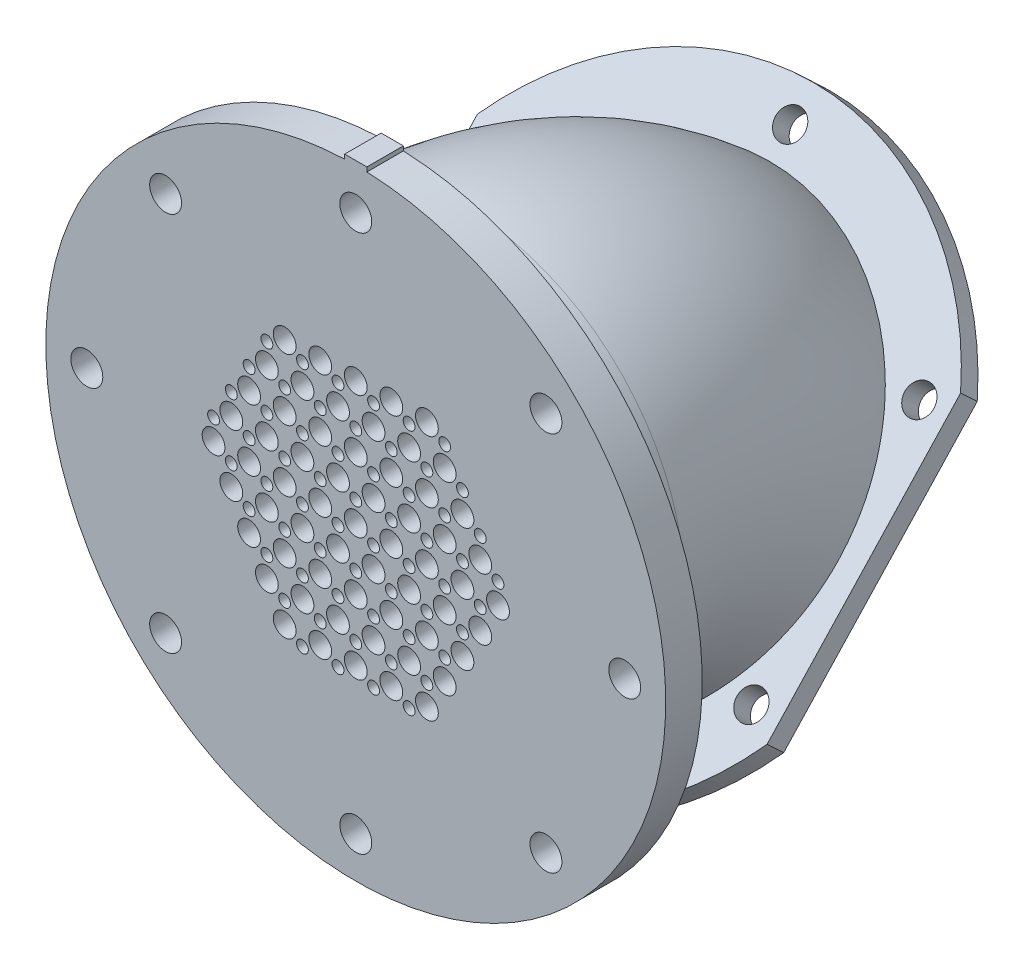
from build123d import *

# Parameters (mm, degrees)
SKETCH1_R               = 20
SKETCH1_R_2             = 1.25
SKETCH1_R_3             = 0.65
SKETCH5_R               = 34
SKETCH5_R_2             = 17.173669099
BOSS_EXTRUDE1_DEPTH     = 4
FILLET1_R               = 2
SKETCH8_R               = 1.75
CUT_EXTRUDE3_DEPTH      = 5
SKETCH10_W              = 107.605507763
SKETCH10_H              = 80.053599659
CUT_EXTRUDE4_DEPTH      = 50
SKETCH18_R              = 24
SKETCH18_R_2            = 19
CUT_EXTRUDE6_DEPTH      = 80.771517757
CUT_EXTRUDE6_DEPTH_BACK = 80.771517757
SKETCH21_R              = 20.75
CUT_EXTRUDE7_DEPTH      = 4.55
SKETCH23_R              = 30.729548531
SKETCH23_R_2            = 22.729548531
BOSS_EXTRUDE2_DEPTH     = 2.5
SKETCH24_R              = 1.6
CUT_EXTRUDE8_DEPTH      = 2.5
SKETCH27_R              = 1.75
CUT_EXTRUDE9_DEPTH      = 5
SKETCH28_W              = 2.436031958
SKETCH28_H              = 0.92316818
BOSS_EXTRUDE3_DEPTH     = 4
SKETCH29_W              = 114.781265496
SKETCH29_H              = 149.582619024
SKETCH29_W_2            = 53
SKETCH29_H_2            = 123.630711616
CUT_EXTRUDE10_DEPTH     = 3


with BuildPart() as part:
    # Sweep1: sweep along a path in Sketch2
    with BuildLine(Plane(origin=(0, 0, 0), x_dir=(0, 0, -1), z_dir=(1, 0, 0))) as sweep1_path:
        Line((0, 0), (12, 0))
        ThreePointArc((12, 0), (31.391260893, -8.032123253), (39.423384146, -27.423384146))
        Line((39.423384146, -27.423384146), (39.423384146, -34.423384146))
    # Sketch1 → Sweep1 (sweep)
    with BuildSketch(Plane.XY):
        Circle(SKETCH1_R)
        Circle(SKETCH1_R_2, mode=Mode.SUBTRACT)
        with Locations((3.9, 0)):
            Circle(SKETCH1_R_2, mode=Mode.SUBTRACT)
        with Locations((7.8, 0)):
            Circle(SKETCH1_R_2, mode=Mode.SUBTRACT)
        with Locations((11.7, 0)):
            Circle(SKETCH1_R_2, mode=Mode.SUBTRACT)
        with Locations((15.6, 0)):
            Circle(SKETCH1_R_2, mode=Mode.SUBTRACT)
        with Locations((1.95, -3.377499075)):
            Circle(SKETCH1_R_2, mode=Mode.SUBTRACT)
        with Locations((3.9, -6.75499815)):
            Circle(SKETCH1_R_2, mode=Mode.SUBTRACT)
        with Locations((5.85, -10.132497224)):
            Circle(SKETCH1_R_2, mode=Mode.SUBTRACT)
        with Locations((7.8, -13.509996299)):
            Circle(SKETCH1_R_2, mode=Mode.SUBTRACT)
        with Locations((-1.95, -3.377499075)):
            Circle(SKETCH1_R_2, mode=Mode.SUBTRACT)
        with Locations((-3.9, -6.75499815)):
            Circle(SKETCH1_R_2, mode=Mode.SUBTRACT)
        with Locations((-5.85, -10.132497224)):
            Circle(SKETCH1_R_2, mode=Mode.SUBTRACT)
        with Locations((-7.8, -13.509996299)):
            Circle(SKETCH1_R_2, mode=Mode.SUBTRACT)
        with Locations((-3.9, 0)):
            Circle(SKETCH1_R_2, mode=Mode.SUBTRACT)
        with Locations((-7.8, 0)):
            Circle(SKETCH1_R_2, mode=Mode.SUBTRACT)
        with Locations((-11.7, 0)):
            Circle(SKETCH1_R_2, mode=Mode.SUBTRACT)
        with Locations((-15.6, 0)):
            Circle(SKETCH1_R_2, mode=Mode.SUBTRACT)
        with Locations((-1.95, 3.377499075)):
            Circle(SKETCH1_R_2, mode=Mode.SUBTRACT)
        with Locations((-3.9, 6.75499815)):
            Circle(SKETCH1_R_2, mode=Mode.SUBTRACT)
        with Locations((-5.85, 10.132497224)):
            Circle(SKETCH1_R_2, mode=Mode.SUBTRACT)
        with Locations((-7.8, 13.509996299)):
            Circle(SKETCH1_R_2, mode=Mode.SUBTRACT)
        with Locations((1.95, 3.377499075)):
            Circle(SKETCH1_R_2, mode=Mode.SUBTRACT)
        with Locations((3.9, 6.75499815)):
            Circle(SKETCH1_R_2, mode=Mode.SUBTRACT)
        with Locations((5.85, 10.132497224)):
            Circle(SKETCH1_R_2, mode=Mode.SUBTRACT)
        with Locations((7.8, 13.509996299)):
            Circle(SKETCH1_R_2, mode=Mode.SUBTRACT)
        with Locations((5.85, 3.377499075)):
            Circle(SKETCH1_R_2, mode=Mode.SUBTRACT)
        with Locations((7.8, 6.75499815)):
            Circle(SKETCH1_R_2, mode=Mode.SUBTRACT)
        with Locations((9.75, 3.377499075)):
            Circle(SKETCH1_R_2, mode=Mode.SUBTRACT)
        with Locations((11.7, 6.75499815)):
            Circle(SKETCH1_R_2, mode=Mode.SUBTRACT)
        with Locations((9.749099848, 10.134056333)):
            Circle(SKETCH1_R_2, mode=Mode.SUBTRACT)
        with Locations((13.650900152, 3.375939966)):
            Circle(SKETCH1_R_2, mode=Mode.SUBTRACT)
        with Locations((5.850000208, -3.379058003)):
            Circle(SKETCH1_R_2, mode=Mode.SUBTRACT)
        with Locations((9.750000208, -3.379058003)):
            Circle(SKETCH1_R_2, mode=Mode.SUBTRACT)
        with Locations((7.800000208, -6.756557078)):
            Circle(SKETCH1_R_2, mode=Mode.SUBTRACT)
        with Locations((11.700000208, -6.756557078)):
            Circle(SKETCH1_R_2, mode=Mode.SUBTRACT)
        with Locations((9.749100056, -10.135615261)):
            Circle(SKETCH1_R_2, mode=Mode.SUBTRACT)
        with Locations((13.650900359, -3.377498895)):
            Circle(SKETCH1_R_2, mode=Mode.SUBTRACT)
        with Locations((-0.00134976, -6.757336722)):
            Circle(SKETCH1_R_2, mode=Mode.SUBTRACT)
        with Locations((1.94865024, -10.134835797)):
            Circle(SKETCH1_R_2, mode=Mode.SUBTRACT)
        with Locations((-1.95134976, -10.134835797)):
            Circle(SKETCH1_R_2, mode=Mode.SUBTRACT)
        with Locations((-0.00134976, -13.512334872)):
            Circle(SKETCH1_R_2, mode=Mode.SUBTRACT)
        with Locations((-3.903150063, -13.512334872)):
            Circle(SKETCH1_R_2, mode=Mode.SUBTRACT)
        with Locations((3.900450543, -13.512334872)):
            Circle(SKETCH1_R_2, mode=Mode.SUBTRACT)
        with Locations((-5.852699936, -3.379058363)):
            Circle(SKETCH1_R_2, mode=Mode.SUBTRACT)
        with Locations((-7.802699936, -6.756557438)):
            Circle(SKETCH1_R_2, mode=Mode.SUBTRACT)
        with Locations((-9.752699936, -3.379058363)):
            Circle(SKETCH1_R_2, mode=Mode.SUBTRACT)
        with Locations((-11.702699936, -6.756557438)):
            Circle(SKETCH1_R_2, mode=Mode.SUBTRACT)
        with Locations((-13.653600087, -3.377499255)):
            Circle(SKETCH1_R_2, mode=Mode.SUBTRACT)
        with Locations((-9.751799784, -10.135615621)):
            Circle(SKETCH1_R_2, mode=Mode.SUBTRACT)
        with Locations((-5.852700144, 3.377498715)):
            Circle(SKETCH1_R_2, mode=Mode.SUBTRACT)
        with Locations((-9.752700144, 3.377498715)):
            Circle(SKETCH1_R_2, mode=Mode.SUBTRACT)
        with Locations((-7.802700144, 6.75499779)):
            Circle(SKETCH1_R_2, mode=Mode.SUBTRACT)
        with Locations((-11.702700144, 6.75499779)):
            Circle(SKETCH1_R_2, mode=Mode.SUBTRACT)
        with Locations((-9.751799992, 10.134055973)):
            Circle(SKETCH1_R_2, mode=Mode.SUBTRACT)
        with Locations((-13.653600295, 3.375939606)):
            Circle(SKETCH1_R_2, mode=Mode.SUBTRACT)
        with Locations((-0.001350176, 6.755777434)):
            Circle(SKETCH1_R_2, mode=Mode.SUBTRACT)
        with Locations((-1.951350176, 10.133276509)):
            Circle(SKETCH1_R_2, mode=Mode.SUBTRACT)
        with Locations((1.948649824, 10.133276509)):
            Circle(SKETCH1_R_2, mode=Mode.SUBTRACT)
        with Locations((-0.001350176, 13.510775583)):
            Circle(SKETCH1_R_2, mode=Mode.SUBTRACT)
        with Locations((3.900450128, 13.510775583)):
            Circle(SKETCH1_R_2, mode=Mode.SUBTRACT)
        with Locations((-3.903150479, 13.510775583)):
            Circle(SKETCH1_R_2, mode=Mode.SUBTRACT)
        with Locations((13.65, -1.125833025)):
            Circle(SKETCH1_R_3, mode=Mode.SUBTRACT)
        with Locations((11.700900359, -4.504371325)):
            Circle(SKETCH1_R_3, mode=Mode.SUBTRACT)
        with Locations((9.750000208, -7.883429509)):
            Circle(SKETCH1_R_3, mode=Mode.SUBTRACT)
        with Locations((7.798650344, -11.259109473)):
            Circle(SKETCH1_R_3, mode=Mode.SUBTRACT)
        with Locations((9.75, -1.125833025)):
            Circle(SKETCH1_R_3, mode=Mode.SUBTRACT)
        with Locations((7.800900359, -4.504371325)):
            Circle(SKETCH1_R_3, mode=Mode.SUBTRACT)
        with Locations((5.850000208, -7.883429509)):
            Circle(SKETCH1_R_3, mode=Mode.SUBTRACT)
        with Locations((3.898650344, -11.259109473)):
            Circle(SKETCH1_R_3, mode=Mode.SUBTRACT)
        with Locations((5.85, -1.125833025)):
            Circle(SKETCH1_R_3, mode=Mode.SUBTRACT)
        with Locations((3.900900359, -4.504371325)):
            Circle(SKETCH1_R_3, mode=Mode.SUBTRACT)
        with Locations((1.950000208, -7.883429509)):
            Circle(SKETCH1_R_3, mode=Mode.SUBTRACT)
        with Locations((-0.001349656, -11.259109473)):
            Circle(SKETCH1_R_3, mode=Mode.SUBTRACT)
        with Locations((1.95, -1.125833025)):
            Circle(SKETCH1_R_3, mode=Mode.SUBTRACT)
        with Locations((0.000900359, -4.504371325)):
            Circle(SKETCH1_R_3, mode=Mode.SUBTRACT)
        with Locations((-1.949999792, -7.883429509)):
            Circle(SKETCH1_R_3, mode=Mode.SUBTRACT)
        with Locations((-3.901349656, -11.259109473)):
            Circle(SKETCH1_R_3, mode=Mode.SUBTRACT)
        with Locations((-1.95, -1.125833025)):
            Circle(SKETCH1_R_3, mode=Mode.SUBTRACT)
        with Locations((-3.899099641, -4.504371325)):
            Circle(SKETCH1_R_3, mode=Mode.SUBTRACT)
        with Locations((-5.849999792, -7.883429509)):
            Circle(SKETCH1_R_3, mode=Mode.SUBTRACT)
        with Locations((-7.801349656, -11.259109473)):
            Circle(SKETCH1_R_3, mode=Mode.SUBTRACT)
        with Locations((-5.85, -1.125833025)):
            Circle(SKETCH1_R_3, mode=Mode.SUBTRACT)
        with Locations((-7.799099641, -4.504371325)):
            Circle(SKETCH1_R_3, mode=Mode.SUBTRACT)
        with Locations((-9.749999792, -7.883429509)):
            Circle(SKETCH1_R_3, mode=Mode.SUBTRACT)
        with Locations((-9.75, -1.125833025)):
            Circle(SKETCH1_R_3, mode=Mode.SUBTRACT)
        with Locations((-11.699099641, -4.504371325)):
            Circle(SKETCH1_R_3, mode=Mode.SUBTRACT)
        with Locations((-13.65, -1.125833025)):
            Circle(SKETCH1_R_3, mode=Mode.SUBTRACT)
        with Locations((0, 2.25166605)):
            Circle(SKETCH1_R_3, mode=Mode.SUBTRACT)
        with Locations((3.9, 2.25166605)):
            Circle(SKETCH1_R_3, mode=Mode.SUBTRACT)
        with Locations((7.8, 2.25166605)):
            Circle(SKETCH1_R_3, mode=Mode.SUBTRACT)
        with Locations((11.7, 2.25166605)):
            Circle(SKETCH1_R_3, mode=Mode.SUBTRACT)
        with Locations((15.6, 2.25166605)):
            Circle(SKETCH1_R_3, mode=Mode.SUBTRACT)
        with Locations((1.949100056, 5.629684708)):
            Circle(SKETCH1_R_3, mode=Mode.SUBTRACT)
        with Locations((5.849100056, 5.629684708)):
            Circle(SKETCH1_R_3, mode=Mode.SUBTRACT)
        with Locations((9.749100056, 5.629684708)):
            Circle(SKETCH1_R_3, mode=Mode.SUBTRACT)
        with Locations((13.649100056, 5.629684708)):
            Circle(SKETCH1_R_3, mode=Mode.SUBTRACT)
        with Locations((3.899100056, 9.007183782)):
            Circle(SKETCH1_R_3, mode=Mode.SUBTRACT)
        with Locations((7.799100056, 9.007183782)):
            Circle(SKETCH1_R_3, mode=Mode.SUBTRACT)
        with Locations((11.699100056, 9.007183782)):
            Circle(SKETCH1_R_3, mode=Mode.SUBTRACT)
        with Locations((5.85, 12.384163274)):
            Circle(SKETCH1_R_3, mode=Mode.SUBTRACT)
        with Locations((9.75, 12.384163274)):
            Circle(SKETCH1_R_3, mode=Mode.SUBTRACT)
        with Locations((5.85, -14.635829324)):
            Circle(SKETCH1_R_3, mode=Mode.SUBTRACT)
        with Locations((1.950899944, -14.635309741)):
            Circle(SKETCH1_R_3, mode=Mode.SUBTRACT)
        with Locations((-1.949100056, -14.635309741)):
            Circle(SKETCH1_R_3, mode=Mode.SUBTRACT)
        with Locations((-5.85, -14.635829324)):
            Circle(SKETCH1_R_3, mode=Mode.SUBTRACT)
        with Locations((-15.6, 2.25166605)):
            Circle(SKETCH1_R_3, mode=Mode.SUBTRACT)
        with Locations((-13.65, 5.628125959)):
            Circle(SKETCH1_R_3, mode=Mode.SUBTRACT)
        with Locations((-11.7, 9.005625033)):
            Circle(SKETCH1_R_3, mode=Mode.SUBTRACT)
        with Locations((-9.75, 12.384163274)):
            Circle(SKETCH1_R_3, mode=Mode.SUBTRACT)
        with Locations((-5.85, 12.384163274)):
            Circle(SKETCH1_R_3, mode=Mode.SUBTRACT)
        with Locations((-1.95, 12.384163274)):
            Circle(SKETCH1_R_3, mode=Mode.SUBTRACT)
        with Locations((1.95, 12.384163274)):
            Circle(SKETCH1_R_3, mode=Mode.SUBTRACT)
        with Locations((-7.8, 9.005625033)):
            Circle(SKETCH1_R_3, mode=Mode.SUBTRACT)
        with Locations((-9.75, 5.628125959)):
            Circle(SKETCH1_R_3, mode=Mode.SUBTRACT)
        with Locations((-11.7, 2.25166605)):
            Circle(SKETCH1_R_3, mode=Mode.SUBTRACT)
        with Locations((-3.9, 9.005625033)):
            Circle(SKETCH1_R_3, mode=Mode.SUBTRACT)
        with Locations((-5.85, 5.628125959)):
            Circle(SKETCH1_R_3, mode=Mode.SUBTRACT)
        with Locations((-7.8, 2.25166605)):
            Circle(SKETCH1_R_3, mode=Mode.SUBTRACT)
        with Locations((0, 9.005625033)):
            Circle(SKETCH1_R_3, mode=Mode.SUBTRACT)
        with Locations((-1.95, 5.628125959)):
            Circle(SKETCH1_R_3, mode=Mode.SUBTRACT)
        with Locations((-3.9, 2.25166605)):
            Circle(SKETCH1_R_3, mode=Mode.SUBTRACT)
    sweep(path=sweep1_path.line)

    # Sketch5 → Boss-Extrude1 (add)
    with BuildSketch(Plane.XY):
        Circle(SKETCH5_R)
        Circle(SKETCH5_R_2, mode=Mode.SUBTRACT)
    extrude(amount=-BOSS_EXTRUDE1_DEPTH)

    # Fillet1
    fillet1_edges = [part.edges().sort_by_distance(p)[0] for p in [
        (-20, 0, -4),
    ]]
    fillet(fillet1_edges, radius=FILLET1_R)

    # Sketch8 → Cut-Extrude3 (cut)
    with BuildSketch(Plane.XY):
        with Locations((-20.859650045, 20.859650045)):
            Circle(SKETCH8_R)
        with Locations((20.859650045, 20.859650045)):
            Circle(SKETCH8_R)
        with Locations((20.859650045, -20.859650045)):
            Circle(SKETCH8_R)
        with Locations((-20.859650045, -20.859650045)):
            Circle(SKETCH8_R)
    extrude(amount=-CUT_EXTRUDE3_DEPTH, mode=Mode.SUBTRACT)

    # Sketch10 → Cut-Extrude4 (cut)
    with BuildSketch(Plane.XY.offset(-10)):
        with Locations((7.049168622, 0.788612068)):
            Rectangle(SKETCH10_W, SKETCH10_H)
    extrude(amount=-CUT_EXTRUDE4_DEPTH, mode=Mode.SUBTRACT)

    # Sweep2: sweep along a path in Sketch2<2>
    with BuildLine(Plane(origin=(0, 0, 0), x_dir=(0, 0, -1), z_dir=(1, 0, 0))) as sweep2_path:
        Line((0, 0), (12, 0))
        ThreePointArc((12, 0), (31.391260893, -8.032123253), (39.423384146, -27.423384146))
        Line((39.423384146, -27.423384146), (39.423384146, -34.423384146))
    # Sketch18 → Sweep2 (sweep)
    with BuildSketch(Plane.XY):
        Circle(SKETCH18_R)
        Circle(SKETCH18_R_2, mode=Mode.SUBTRACT)
    sweep(path=sweep2_path.line)

    # Sketch9 → Cut-Extrude6 (cut, two sides: drawn at the far end of the back side and taken through both)
    with BuildSketch(Plane(origin=(0, 0, 0), x_dir=(0, 0, -1), z_dir=(1, 0, 0)).offset(-CUT_EXTRUDE6_DEPTH_BACK)):
        Polygon((17.249125269, -22.174258877), (55.092197309, 18.379670426), (79.742003971, -4.62240176), (81.44279688, -51.391669716), (9.251283321, -51.391669716), (8.528618039, -31.519452452), align=None)
    extrude(amount=CUT_EXTRUDE6_DEPTH + CUT_EXTRUDE6_DEPTH_BACK, mode=Mode.SUBTRACT)

    # Sketch21 → Cut-Extrude7 (cut)
    with BuildSketch(Plane(origin=(0, -18.92525353, -20.280948462), x_dir=(-1, 0, 0), z_dir=(0, -0.6822482773295654, -0.7311205701393174))):
        with Locations((0.001350176, 15.34834156)):
            Circle(SKETCH21_R)
    extrude(amount=-CUT_EXTRUDE7_DEPTH, mode=Mode.SUBTRACT)

    # Sketch23 → Boss-Extrude2 (add)
    with BuildSketch(Plane(origin=(0, -18.92525353, -20.280948462), x_dir=(-1, 0, 0), z_dir=(0, -0.6822482773295654, -0.7311205701393174))):
        with Locations((0.001350176, 15.786588008)):
            Circle(SKETCH23_R)
        with Locations((0.001350176, 15.786588008)):
            Circle(SKETCH23_R_2, mode=Mode.SUBTRACT)
    extrude(amount=-BOSS_EXTRUDE2_DEPTH)

    # Sketch24 → Cut-Extrude8 (cut)
    with BuildSketch(Plane(origin=(0, -17.219632836, -18.453147036), x_dir=(1, 0, 0), z_dir=(0, 0.6822482773295654, 0.7311205701393173))):
        with Locations((-2.53e-06, 42.787822162)):
            Circle(SKETCH24_R)
        with Locations((23.38200952, 29.286655083)):
            Circle(SKETCH24_R)
        with Locations((23.380661875, 2.286655117)):
            Circle(SKETCH24_R)
        with Locations((-0.002697821, -11.212177771)):
            Circle(SKETCH24_R)
        with Locations((-23.384709872, 2.288989308)):
            Circle(SKETCH24_R)
        with Locations((-23.383362226, 29.288989274)):
            Circle(SKETCH24_R)
    extrude(amount=-CUT_EXTRUDE8_DEPTH, mode=Mode.SUBTRACT)

    # Sketch27 → Cut-Extrude9 (cut)
    with BuildSketch(Plane.XY):
        with Locations((0, 29.5)):
            Circle(SKETCH27_R)
        with Locations((29.5, 0)):
            Circle(SKETCH27_R)
        with Locations((0, -29.5)):
            Circle(SKETCH27_R)
        with Locations((-29.5, 0)):
            Circle(SKETCH27_R)
    extrude(amount=-CUT_EXTRUDE9_DEPTH, mode=Mode.SUBTRACT)

    # Sketch28 → Boss-Extrude3 (add)
    with BuildSketch(Plane.XY):
        with Locations((0, 34)):
            Rectangle(SKETCH28_W, SKETCH28_H)
    extrude(amount=-BOSS_EXTRUDE3_DEPTH)

    # Sketch29 → Cut-Extrude10 (cut)
    with BuildSketch(Plane(origin=(0, -18.92525353, -20.280948462), x_dir=(-1, 0, 0), z_dir=(0, -0.6822482773295654, -0.7311205701393174))):
        Rectangle(SKETCH29_W, SKETCH29_H)
        Rectangle(SKETCH29_W_2, SKETCH29_H_2, mode=Mode.SUBTRACT)
    extrude(amount=-CUT_EXTRUDE10_DEPTH, mode=Mode.SUBTRACT)


solid = part.part
